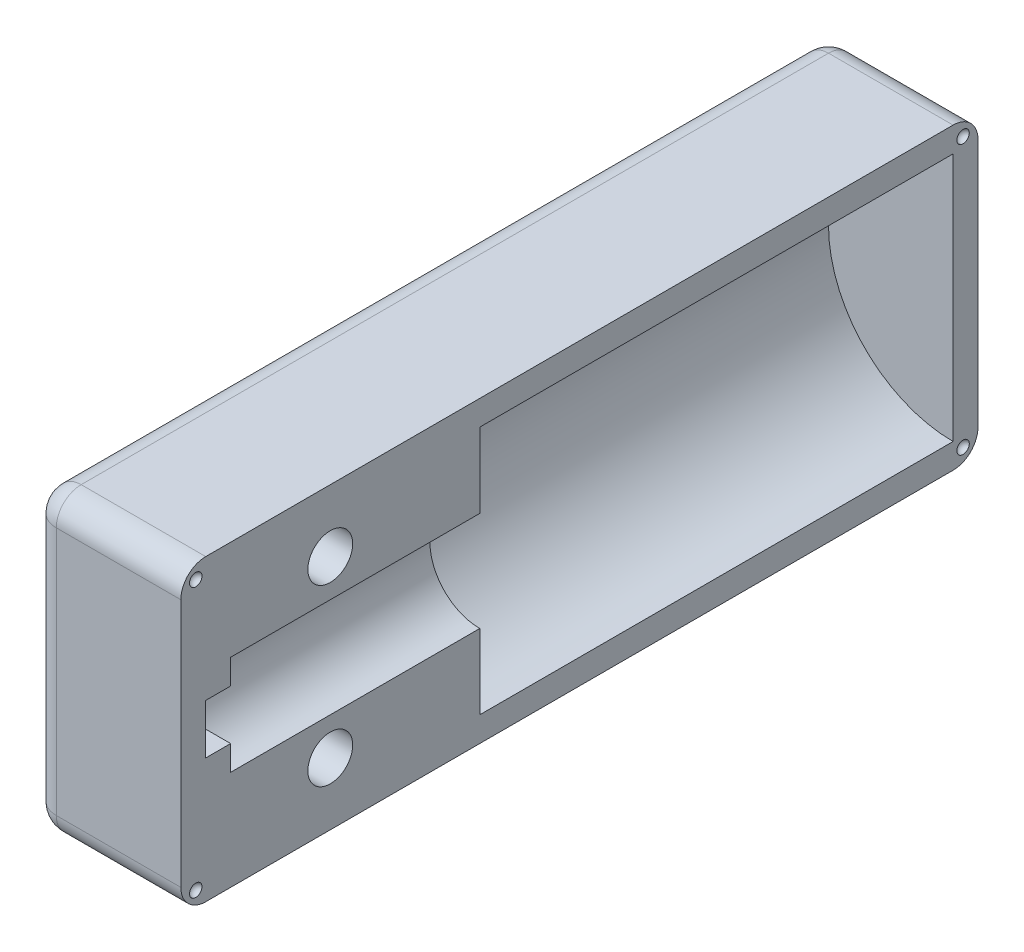
from build123d import *

# Parameters (mm, degrees)
SKETCH1_W               = 6
SKETCH1_H               = 12
BOSS_EXTRUDE1_DEPTH     = 20
SKETCH2_R               = 5
CUT_EXTRUDE1_DEPTH      = 19
SKETCH6_W               = 6
SKETCH6_H               = 12
BOSS_EXTRUDE3_DEPTH     = 12
SKETCH7_R               = 2
CUT_EXTRUDE2_DEPTH      = 10
CUT_EXTRUDE3_DEPTH      = 25.083189158
CUT_EXTRUDE3_DEPTH_BACK = 25.083189158
SKETCH8_W               = 1
SKETCH8_H               = 2
FILLET1_R               = 1
SKETCH10_R              = 0.9
CUT_EXTRUDE4_DEPTH      = 10
CUT_EXTRUDE5_DEPTH      = 2


with BuildPart() as part:
    # Sketch1 → Boss-Extrude1 (new body)
    with BuildSketch(Plane.XY):
        with Locations((3, 6)):
            Rectangle(SKETCH1_W, SKETCH1_H)
    extrude(amount=-BOSS_EXTRUDE1_DEPTH)

    # Sketch2 → Cut-Extrude1 (cut)
    with BuildSketch(Plane.XY):
        with Locations((6, 6)):
            Circle(SKETCH2_R)
    extrude(amount=-CUT_EXTRUDE1_DEPTH, mode=Mode.SUBTRACT)

    # Sketch6 → Boss-Extrude3 (add)
    with BuildSketch(Plane.XY):
        with Locations((3, 6)):
            Rectangle(SKETCH6_W, SKETCH6_H)
    extrude(amount=BOSS_EXTRUDE3_DEPTH)

    # Sketch7 → Cut-Extrude2 (cut)
    with BuildSketch(Plane(origin=(0, 0, 0), x_dir=(-1, 0, 0), z_dir=(0, 0, -1))):
        with Locations((-6, 6)):
            Circle(SKETCH7_R)
    extrude(amount=-CUT_EXTRUDE2_DEPTH, mode=Mode.SUBTRACT)

    # Sketch8 → Cut-Extrude3 (cut, two sides: drawn at the far end of the back side and taken through both)
    with BuildSketch(Plane.ZY.offset(-CUT_EXTRUDE3_DEPTH_BACK)):
        with Locations((10.5, 6)):
            Rectangle(SKETCH8_W, SKETCH8_H)
    extrude(amount=CUT_EXTRUDE3_DEPTH + CUT_EXTRUDE3_DEPTH_BACK, mode=Mode.SUBTRACT)

    # Fillet1
    fillet1_edges = [part.edges().sort_by_distance(p)[0] for p in [
        (3, 0, -20),
        (3, 12, 12),
        (0, 6, 12),
        (3, 0, 12),
        (0, 6, -20),
        (0, 0, -4),
        (0, 12, -4),
        (3, 12, -20),
    ]]
    fillet(fillet1_edges, radius=FILLET1_R - 0.0001)  # a hair under: the kernel refuses the full size

    # Sketch10 → Cut-Extrude4 (cut)
    with BuildSketch(Plane(origin=(6, 0, 0), x_dir=(0, 0, -1), z_dir=(1, 0, 0))):
        with Locations((-6, 9.5)):
            Circle(SKETCH10_R)
    cut_extrude4 = extrude(amount=-CUT_EXTRUDE4_DEPTH, mode=Mode.SUBTRACT)

    # Sketch12 → Cut-Extrude5 (cut)
    with BuildSketch(Plane.ZY):
        Polygon((6.923760431, 7.9), (7.847520861, 9.5), (6.923760431, 11.1), (5.076239569, 11.1), (4.152479139, 9.5), (5.076239569, 7.9), align=None)
    cut_extrude5 = extrude(amount=-CUT_EXTRUDE5_DEPTH, mode=Mode.SUBTRACT)

    # Mirror1: Cut-Extrude4, Cut-Extrude5 across plane
    add(cut_extrude4.mirror(Plane.ZX.offset(6)), mode=Mode.SUBTRACT)
    add(cut_extrude5.mirror(Plane.ZX.offset(6)), mode=Mode.SUBTRACT)

    # Sketch11 → Cut-Revolve1 (revolve, cut)
    with BuildSketch(Plane(origin=(0, 0, -19.4), x_dir=(-1, 0, 0), z_dir=(0, 0, -1))):
        with BuildLine():
            Line((-5.75, 11.4), (-6, 11.4))
            Line((-6, 11.4), (-6, 11.15))
            ThreePointArc((-6, 11.15), (-5.823223305, 11.223223305), (-5.75, 11.4))
        make_face()
    cut_revolve1 = revolve(axis=Axis((5.75, 11.4, -19.4), (1, 0, 0)), mode=Mode.SUBTRACT)

    # Mirror2: Cut-Revolve1 across plane
    add(cut_revolve1.mirror(Plane.ZX.offset(6)), mode=Mode.SUBTRACT)

    # Mirror2 at the second plane: Cut-Revolve1 across plane
    add(cut_revolve1.mirror(Plane.XY.offset(-4)), mode=Mode.SUBTRACT)

    # Mirror2 at the second plane copy 1 sketc → Mirror2 at the second plane copy 1 (revolve, cut)
    with BuildSketch(Plane(origin=(0, 12, 11.4), x_dir=(-1, 0, 0), z_dir=(0, 0, 1))):
        with BuildLine():
            Line((-5.75, 11.4), (-6, 11.4))
            Line((-6, 11.4), (-6, 11.15))
            ThreePointArc((-6, 11.15), (-5.823223305, 11.223223305), (-5.75, 11.4))
        make_face()
    revolve(axis=Axis((5.75, 0.6, 11.4), (1, 0, 0)), mode=Mode.SUBTRACT)


solid = part.part
